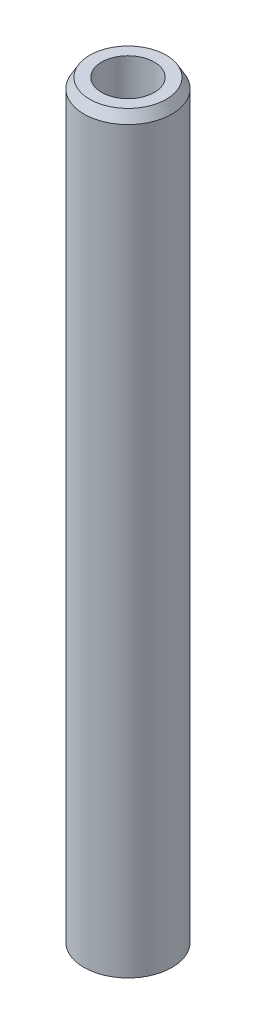
from build123d import *
from OCP.BRepFilletAPI import BRepFilletAPI_MakeChamfer

# Parameters (mm, degrees)
SKETCH1_R           = 25
BOSS_EXTRUDE1_DEPTH = 428.966920491
SKETCH2_R           = 14.966929265
CUT_EXTRUDE1_DEPTH  = 431.421443327
CHAMFER1_SIZE       = 5.653692972
CHAMFER1_SIZE2      = 3.264161159


with BuildPart() as part:
    # Sketch1 → Boss-Extrude1 (new body)
    with BuildSketch(Plane(origin=(0, 0, 0), x_dir=(1, 0, 0), z_dir=(0, 1, 0))):
        Circle(SKETCH1_R)
    extrude(amount=BOSS_EXTRUDE1_DEPTH)

    # Sketch2 → Cut-Extrude1 (cut, through all)
    with BuildSketch(Plane(origin=(0, 0, 0), x_dir=(1, 0, 0), z_dir=(0, 1, 0))):
        Circle(SKETCH2_R)
    extrude(amount=CUT_EXTRUDE1_DEPTH, mode=Mode.SUBTRACT)

    # Chamfer1: one chamfer whose edges measure the first distance from different faces: ONE call of the kernel's chamfer builder (chamfer() names one face for all edges)
    chamfer1_edges_1 = [part.edges().sort_by_distance(p)[0] for p in [
        (-25, 428.966920491, 0),
    ]]
    chamfer1_side_1 = [part.faces().sort_by_distance(p)[0] for p in [
        (-25, 214.483460245, 0),
    ]]
    chamfer1_edges_2 = [part.edges().sort_by_distance(p)[0] for p in [
        (-25, 0, 0),
    ]]
    chamfer1_side_2 = [part.faces().sort_by_distance(p)[0] for p in [
        (-24.292893219, 0, 0),
    ]]
    chamfer1 = BRepFilletAPI_MakeChamfer(part.part.solid().wrapped)
    for e in chamfer1_edges_1:
        chamfer1.Add(CHAMFER1_SIZE, CHAMFER1_SIZE2, e.wrapped, chamfer1_side_1[0].wrapped)  # the first distance lies on this face
    for e in chamfer1_edges_2:
        chamfer1.Add(CHAMFER1_SIZE, CHAMFER1_SIZE2, e.wrapped, chamfer1_side_2[0].wrapped)  # the first distance lies on this face
    add(Compound.cast(chamfer1.Shape()), mode=Mode.REPLACE)


solid = part.part
